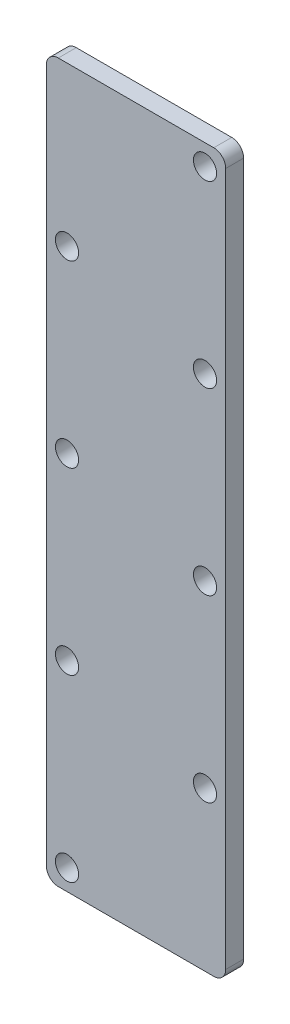
from build123d import *

# Parameters (mm, degrees)
BOSS_EXTRU_1_DEPTH   = 3
EMPREINTE1_OUTLINE_R = 1.938
EMPREINTE1_DEPTH     = 3


# Read off the part's stored shape, not the designer's step: Empreinte1
with BuildPart() as part:
    # Esquisse1 → Boss.-Extru.1 (new body)
    with BuildSketch(Plane.XY):
        with BuildLine():
            Line((2, 0), (28, 0))
            ThreePointArc((28, 0), (29.414213562, 0.585786438), (30, 2))
            Line((30, 2), (30, 118))
            ThreePointArc((30, 118), (29.414213562, 119.414213562), (28, 120))
            Line((28, 120), (2, 120))
            ThreePointArc((2, 120), (0.585786438, 119.414213562), (0, 118))
            Line((0, 118), (0, 2))
            ThreePointArc((0, 2), (0.585786438, 0.585786438), (2, 0))
        make_face()
    extrude(amount=BOSS_EXTRU_1_DEPTH)

    # Empreinte1 outline → Empreinte1 (cut)
    with BuildSketch(Plane.XY):
        with Locations((26.535185944, 116.535185944)):
            Circle(EMPREINTE1_OUTLINE_R)
        with Locations((3.460697179, 93.460697179)):
            Circle(EMPREINTE1_OUTLINE_R)
        with Locations((26.535185944, 86.535185944)):
            Circle(EMPREINTE1_OUTLINE_R)
        with Locations((3.460697179, 63.460697179)):
            Circle(EMPREINTE1_OUTLINE_R)
        with Locations((26.535185944, 56.535185944)):
            Circle(EMPREINTE1_OUTLINE_R)
        with Locations((3.460697179, 33.460697179)):
            Circle(EMPREINTE1_OUTLINE_R)
        with Locations((26.535185944, 26.535185944)):
            Circle(EMPREINTE1_OUTLINE_R)
        with Locations((3.460697179, 3.460697179)):
            Circle(EMPREINTE1_OUTLINE_R)
    extrude(amount=EMPREINTE1_DEPTH, mode=Mode.SUBTRACT)


solid = part.part
